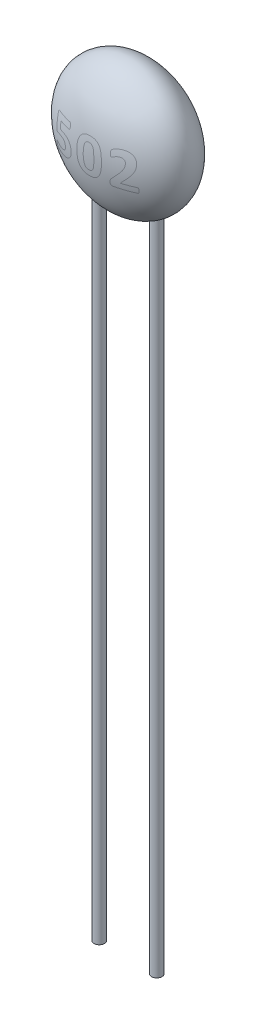
from build123d import *

# Parameters (mm, degrees)
SKETCH3_R           = 0.23
BOSS_EXTRUDE1_DEPTH = 31.5


with BuildPart() as part:
    # Sketch1 → Revolve1 (revolve)
    with BuildSketch(Plane(origin=(0, 0, 0), x_dir=(0, 0, -1), z_dir=(1, 0, 0))):
        with BuildLine():
            Line((-1.75, 0), (1.75, 0))
            add(Edge.make_bspline(
                [(1.75, 0), (1.75, 2.9), (0, 2.9), (-1.75, 2.9), (-1.75, 0)],
                knots=[1.570796327, 1.570796327, 1.570796327, 3.141592654, 3.141592654, 4.71238898, 4.71238898, 4.71238898], degree=2, weights=[1, 0.707106781, 1, 0.707106781, 1]))
        make_face()
    revolve(axis=Axis((0, 0, 1.75), (0, 0, -1)))

    # Sketch3 → Boss-Extrude1 (add)
    with BuildSketch(Plane(origin=(0, 0, 0), x_dir=(1, 0, 0), z_dir=(0, 1, 0))):
        with Locations((-1.27, 0)):
            Circle(SKETCH3_R)
        with Locations((1.27, 0)):
            Circle(SKETCH3_R)
    extrude(amount=-BOSS_EXTRUDE1_DEPTH)


solid = part.part
